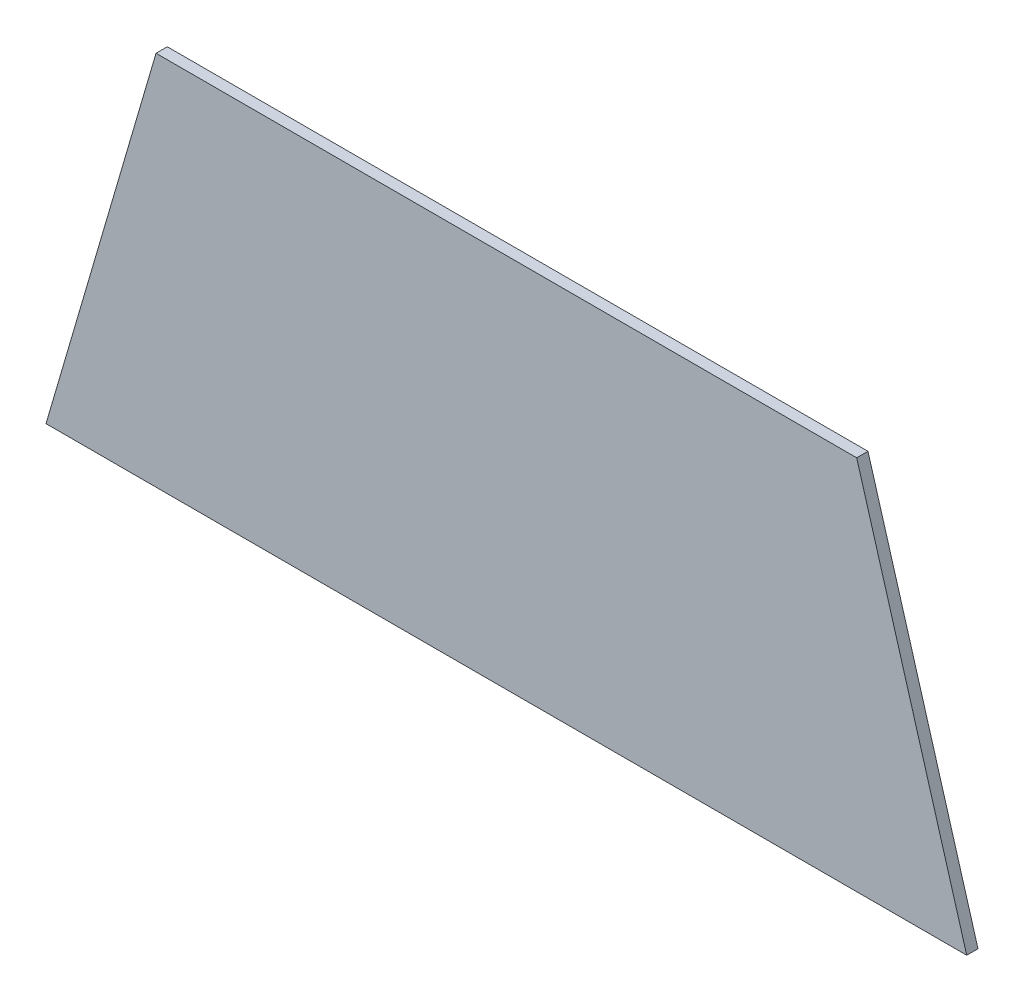
from build123d import *

# Parameters (mm, degrees)
BOSS_EXTRUDE1_DEPTH = 3


with BuildPart() as part:
    # Sketch1 → Boss-Extrude1 (new body)
    with BuildSketch(Plane.XY):
        Polygon((0, 0), (245, 0), (215.720058283, 100), (29.279941717, 100), align=None)
    extrude(amount=BOSS_EXTRUDE1_DEPTH)


solid = part.part
